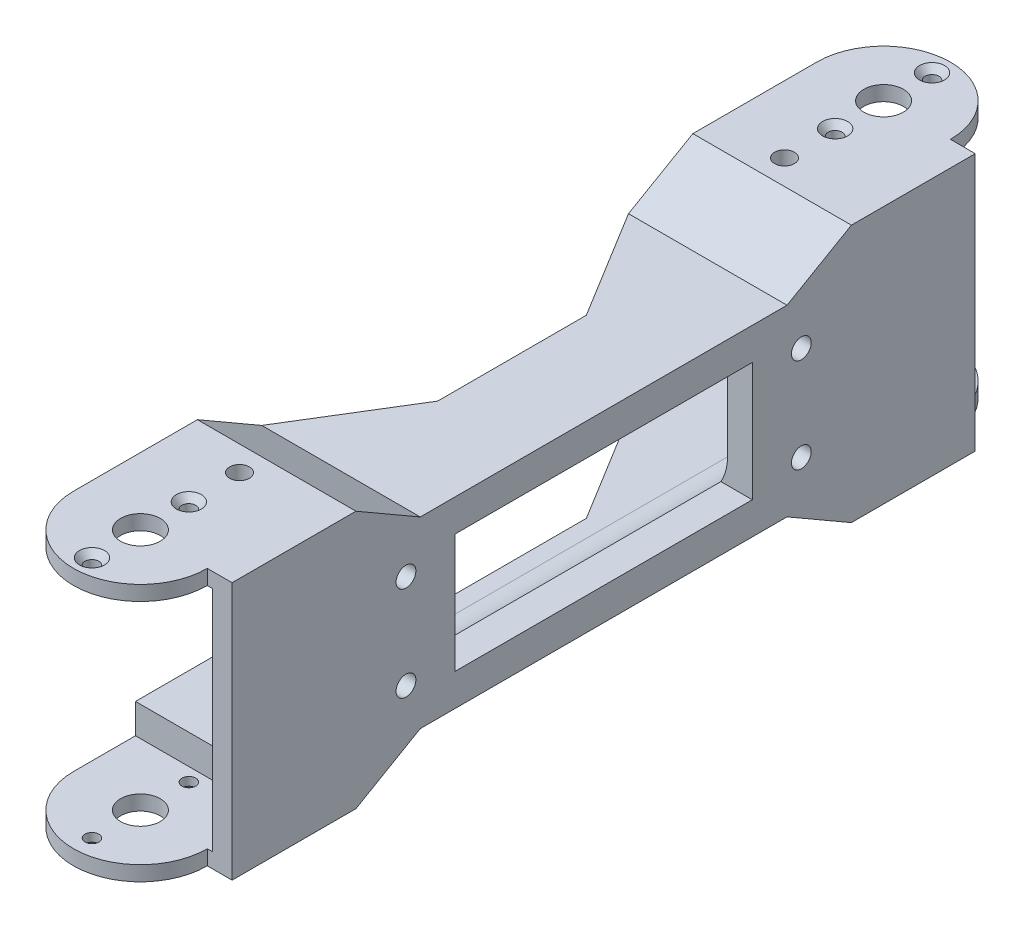
from build123d import *

# Parameters (mm, degrees)
SKETCH1_R                                     = 2
BOSS_EXTRUDE1_DEPTH                           = 26
CUT_EXTRUDE1_DEPTH                            = 97.110613358
CUT_EXTRUDE2_DEPTH                            = 97.110613358
CUT_EXTRUDE2_DEPTH_BACK                       = 97.110613358
SKETCH4_W                                     = 26
SKETCH4_H                                     = 6
SKETCH5_W                                     = 177
SKETCH5_H                                     = 34
CUT_EXTRUDE3_DEPTH                            = 22
SKETCH6_W                                     = 22.988088482
SKETCH6_H                                     = 34
CUT_EXTRUDE4_DEPTH                            = 95.827474922
SKETCH7_W                                     = 22.988088482
SKETCH7_H                                     = 34
CUT_EXTRUDE5_DEPTH                            = 95.827474922
CSK_FOR_3_FLAT_HEAD_MACHINE_SCREW1_AT_2_COUNT = 2
CSK_FOR_3_FLAT_HEAD_MACHINE_SCREW1_AT_2_PITCH = 19.558
SKETCH13_R                                    = 4
CUT_EXTRUDE6_DEPTH                            = 104.530188834
BOSS_EXTRUDE2_DEPTH                           = 5
SKETCH15_W                                    = 125
SKETCH15_H                                    = 34
CUT_EXTRUDE7_DEPTH                            = 5
SKETCH17_W                                    = 4
SKETCH17_H                                    = 52
BOSS_EXTRUDE4_DEPTH                           = 12.5
SKETCH19_R                                    = 2
CUT_EXTRUDE11_DEPTH                           = 10
CUT_EXTRUDE8_REACH                            = 106.3
SKETCH18_R                                    = 2
SKETCH20_W                                    = 60
SKETCH20_H                                    = 24
CUT_EXTRUDE10_DEPTH                           = 10
CUT_EXTRUDE12_REACH                           = 102.771
SKETCH22_W                                    = 5
SKETCH22_H                                    = 46
BOSS_EXTRUDE5_DEPTH                           = 12.5
FILLET1_R                                     = 10


with BuildPart() as part:
    # Sketch1 → Boss-Extrude1 (new, symmetric)
    with BuildSketch(Plane(origin=(0, 0, 0), x_dir=(1, 0, 0), z_dir=(0, 1, 0))):
        with BuildLine():
            Line((-13.5, 75), (-13.5, -75))
            ThreePointArc((-13.5, -75), (0, -88.5), (13.5, -75))
            Line((13.5, -75), (13.5, 75))
            ThreePointArc((13.5, 75), (0, 88.5), (-13.5, 75))
        make_face()
        with Locations(Location((0, -55, 0), (0, 0, 90))):
            Circle(SKETCH1_R, mode=Mode.SUBTRACT)
    extrude(amount=BOSS_EXTRUDE1_DEPTH, both=True)

    # Sketch3 → Cut-Extrude1 (cut, symmetric)
    with BuildSketch(Plane.ZY.offset(13.5)):
        Polygon((-50, 26), (-37.009618943, 18.5), (37.009618943, 18.5), (50, 26), align=None)
    cut_extrude1 = extrude(amount=CUT_EXTRUDE1_DEPTH, both=True, mode=Mode.SUBTRACT)

    # Mirror1: Cut-Extrude1 across plane
    add(cut_extrude1.mirror(Plane.ZX), mode=Mode.SUBTRACT)

    # Sketch4 → Cut-Extrude2 (cut, two sides: drawn at the far end of the back side and taken through both)
    with BuildSketch(Plane.ZY.offset(13.5).offset(-CUT_EXTRUDE2_DEPTH_BACK)):
        with Locations((75.5, 20)):
            Rectangle(SKETCH4_W, SKETCH4_H)
        with Locations((-75.5, 20)):
            Rectangle(SKETCH4_W, SKETCH4_H)
        with Locations((-75.5, -20)):
            Rectangle(SKETCH4_W, SKETCH4_H)
        with Locations((75.5, -20)):
            Rectangle(SKETCH4_W, SKETCH4_H)
    extrude(amount=CUT_EXTRUDE2_DEPTH + CUT_EXTRUDE2_DEPTH_BACK, mode=Mode.SUBTRACT)

    # Sketch5 → Cut-Extrude3 (cut)
    with BuildSketch(Plane.ZY.offset(13.5)):
        Rectangle(SKETCH5_W, SKETCH5_H)
    extrude(amount=-CUT_EXTRUDE3_DEPTH, mode=Mode.SUBTRACT)

    # Sketch6 → Cut-Extrude4 (cut, through all)
    with BuildSketch(Plane.ZY.offset(-8.5)):
        with Locations((73.994044241, 0)):
            Rectangle(SKETCH6_W, SKETCH6_H)
    extrude(amount=-CUT_EXTRUDE4_DEPTH, mode=Mode.SUBTRACT)

    # Sketch7 → Cut-Extrude5 (cut, through all)
    with BuildSketch(Plane.ZY.offset(-8.5)):
        with Locations((-73.994044241, 0)):
            Rectangle(SKETCH7_W, SKETCH7_H)
    extrude(amount=-CUT_EXTRUDE5_DEPTH, mode=Mode.SUBTRACT)

    # Sketch12 → CSK for #3 Flat Head Machine Screw1 (revolve, cut)
    with BuildSketch(Plane(origin=(0, 26, 65.221), x_dir=(0, 0, 1), z_dir=(1, 0, 0))):
        Polygon((0, 0), (0, 3.839402285), (1.397, 3), (1.397, 1.300261411), (2.5273, 0), align=None)
    csk_for_3_flat_head_machine_screw1 = revolve(axis=Axis((0, 32.35, 65.221), (0, -1, 0)), mode=Mode.SUBTRACT)

    # CSK for #3 Flat Head Machine Screw1 at 2: CSK for #3 Flat Head Machine Screw1 ×2
    with Locations(*[(0, 0, i * CSK_FOR_3_FLAT_HEAD_MACHINE_SCREW1_AT_2_PITCH) for i in range(1, CSK_FOR_3_FLAT_HEAD_MACHINE_SCREW1_AT_2_COUNT)]):
        add(csk_for_3_flat_head_machine_screw1, mode=Mode.SUBTRACT)

    # Mirror5: CSK for #3 Flat Head Machine Screw1 across plane
    add(csk_for_3_flat_head_machine_screw1.mirror(Plane.ZX), mode=Mode.SUBTRACT)

    # Mirror5 copy 1 sketch → Mirror5 copy 1 (revolve, cut)
    with BuildSketch(Plane(origin=(0, -26, 84.779), x_dir=(0, 0, 1), z_dir=(1, 0, 0))):
        Polygon((0, 0), (0, -3.839402285), (1.397, -3), (1.397, -1.300261411), (2.5273, 0), align=None)
    revolve(axis=Axis((0, -32.35, 84.779), (0, -1, 0)), mode=Mode.SUBTRACT)

    # Mirror3: CSK for #3 Flat Head Machine Screw1 across plane
    add(csk_for_3_flat_head_machine_screw1.mirror(Plane.XY), mode=Mode.SUBTRACT)

    # Mirror3 copy 1 sketch → Mirror3 copy 1 (revolve, cut)
    with BuildSketch(Plane(origin=(0, 26, -84.779), x_dir=(0, 0, -1), z_dir=(1, 0, 0))):
        Polygon((0, 0), (0, -3.839402285), (1.397, -3), (1.397, -1.300261411), (2.5273, 0), align=None)
    revolve(axis=Axis((0, 32.35, -84.779), (0, 1, 0)), mode=Mode.SUBTRACT)

    # Sketch13 → Cut-Extrude6 (cut, symmetric)
    with BuildSketch(Plane.XZ.offset(26)):
        with Locations(Location((0, -75, 0), (0, 0, 270))):
            Circle(SKETCH13_R)
    cut_extrude6 = extrude(amount=CUT_EXTRUDE6_DEPTH, both=True, mode=Mode.SUBTRACT)

    # Mirror4: Cut-Extrude6 across plane
    add(cut_extrude6.mirror(Plane.XY), mode=Mode.SUBTRACT)

    # Sketch14 → Boss-Extrude2 (add)
    with BuildSketch(Plane(origin=(13.5, 0, 0), x_dir=(0, 0, -1), z_dir=(1, 0, 0))):
        Polygon((-75, 26), (-75, 23), (-62.5, 23), (-62.5, -23), (-75, -23), (-75, -26), (-50, -26), (-37.009618943, -18.5), (37.009618943, -18.5), (50, -26), (75, -26), (75, -23), (62.5, -23), (62.5, 23), (75, 23), (75, 26), (50, 26), (37.009618943, 18.5), (-37.009618943, 18.5), (-50, 26), align=None)
    extrude(amount=BOSS_EXTRUDE2_DEPTH)

    # Sketch15 → Cut-Extrude7 (cut)
    with BuildSketch(Plane.ZY.offset(-8.5)):
        Rectangle(SKETCH15_W, SKETCH15_H)
    extrude(amount=-CUT_EXTRUDE7_DEPTH, mode=Mode.SUBTRACT)

    # Sketch17 → Boss-Extrude4 (add)
    with BuildSketch(Plane.XY.offset(62.5)):
        with Locations((16.5, 0)):
            Rectangle(SKETCH17_W, SKETCH17_H)
    extrude(amount=BOSS_EXTRUDE4_DEPTH)

    # Mirror6 copy 1 sketch → Mirror6 copy 1 (revolve, cut)
    with BuildSketch(Plane(origin=(0, -26, -65.221), x_dir=(0, 0, -1), z_dir=(1, 0, 0))):
        Polygon((0, 0), (0, 3.839402285), (1.397, 3), (1.397, 1.300261411), (2.5273, 0), align=None)
    revolve(axis=Axis((0, -32.35, -65.221), (0, 1, 0)), mode=Mode.SUBTRACT)

    # Mirror6 copy 2 sketch → Mirror6 copy 2 (revolve, cut)
    with BuildSketch(Plane(origin=(0, -26, -84.779), x_dir=(0, 0, -1), z_dir=(1, 0, 0))):
        Polygon((0, 0), (0, 3.839402285), (1.397, 3), (1.397, 1.300261411), (2.5273, 0), align=None)
    revolve(axis=Axis((0, -32.35, -84.779), (0, 1, 0)), mode=Mode.SUBTRACT)

    # Mirror6 copy 3 sketch → Mirror6 copy 3 (revolve, cut)
    with BuildSketch(Plane(origin=(0, -26, 65.221), x_dir=(0, 0, 1), z_dir=(1, 0, 0))):
        Polygon((0, 0), (0, -3.839402285), (1.397, -3), (1.397, -1.300261411), (2.5273, 0), align=None)
    revolve(axis=Axis((0, -32.35, 65.221), (0, -1, 0)), mode=Mode.SUBTRACT)

    # Mirror6 copy 4 sketch → Mirror6 copy 4 (revolve, cut)
    with BuildSketch(Plane(origin=(0, -26, 84.779), x_dir=(0, 0, 1), z_dir=(1, 0, 0))):
        Polygon((0, 0), (0, -3.839402285), (1.397, -3), (1.397, -1.300261411), (2.5273, 0), align=None)
    revolve(axis=Axis((0, -32.35, 84.779), (0, -1, 0)), mode=Mode.SUBTRACT)

    # Sketch19 → Cut-Extrude11 (cut)
    with BuildSketch(Plane(origin=(18.5, 0, 0), x_dir=(0, 0, -1), z_dir=(1, 0, 0))):
        with Locations((-39.898979486, 9.525)):
            Circle(SKETCH19_R)
        with Locations((-39.898979486, -9.525)):
            Circle(SKETCH19_R)
    cut_extrude11 = extrude(amount=-CUT_EXTRUDE11_DEPTH, mode=Mode.SUBTRACT)

    # Cut-Extrude8: up to this face of the body (flat: up to its plane)
    cut_extrude8_end = Plane(part.part.faces().sort_by_distance((0, -26, -87.99937539))[0])
    # Sketch18 → Cut-Extrude8 (cut, up to the picked face)
    with BuildSketch(Plane(origin=(0, 26, 0), x_dir=(1, 0, 0), z_dir=(0, 1, 0)), mode=Mode.PRIVATE) as cut_extrude8_sk1:
        with Locations(Location((0, 55, 0), (0, 0, 270))):
            Circle(SKETCH18_R)
    cut_extrude8_tool1 = split(extrude(cut_extrude8_sk1.sketch, amount=-CUT_EXTRUDE8_REACH, mode=Mode.PRIVATE), bisect_by=cut_extrude8_end, keep=Keep.BOTH, mode=Mode.PRIVATE)
    add(cut_extrude8_tool1.solids().sort_by(Axis((0, 26, -55), (0, -1, 0)))[0], mode=Mode.SUBTRACT)

    # Sketch20 → Cut-Extrude10 (cut)
    with BuildSketch(Plane.ZY.offset(-13.5)):
        Rectangle(SKETCH20_W, SKETCH20_H)
    extrude(amount=-CUT_EXTRUDE10_DEPTH, mode=Mode.SUBTRACT)

    # Mirror7: Cut-Extrude11 across plane
    add(cut_extrude11.mirror(Plane.XY), mode=Mode.SUBTRACT)

    # Sketch21 → Cut-Extrude12 (cut, up to next)
    with BuildSketch(Plane(origin=(0, 18.5, 0), x_dir=(1, 0, 0), z_dir=(0, 1, 0)), mode=Mode.PRIVATE) as cut_extrude12_sk1:
        Polygon((-13.5, 37.009618943), (0, 15), (0, -15), (-13.5, -37.009618943), align=None)
    cut_extrude12_tool1 = extrude(cut_extrude12_sk1.sketch, amount=-CUT_EXTRUDE12_REACH, mode=Mode.PRIVATE) & part.part
    add(cut_extrude12_tool1.solids().sort_by_distance((-7.702163, 18.5, 0))[0], mode=Mode.SUBTRACT)
    add(cut_extrude12_tool1.solids().sort_by_distance((-7.702163, 18.5, 0))[1], mode=Mode.SUBTRACT)

    # Sketch22 → Boss-Extrude5 (add)
    with BuildSketch(Plane(origin=(0, 0, -62.5), x_dir=(-1, 0, 0), z_dir=(0, 0, -1))):
        with Locations((-16, 0)):
            Rectangle(SKETCH22_W, SKETCH22_H)
    extrude(amount=BOSS_EXTRUDE5_DEPTH)

    # Fillet1
    # the kernel refuses this fillet: 10 mm, written as the material it adds along each edge
    with BuildSketch(Plane(origin=(13.5, 17, -62.5), x_dir=(0, -1, 0), z_dir=(0, 0, 1))) as fillet1_piece_1_section:
        with BuildLine():
            CenterArc((FILLET1_R, -FILLET1_R), FILLET1_R, 90, 90)
            Line((0, -FILLET1_R), (0, 0))
            Line((0, 0), (FILLET1_R, 0))
        make_face()
    fillet1_piece_1 = extrude(amount=150, mode=Mode.PRIVATE)
    fillet1_piece_1 = fillet1_piece_1 - Plane(origin=(13.095089825, 9.525, -39.898979486), x_dir=(0, 0, 1), z_dir=(1, 0, 0)) * Cylinder(2, 341, mode=Mode.PRIVATE)
    fillet1_piece_1 = split(fillet1_piece_1, bisect_by=Plane(origin=(13.095089825, 10.807057583, -30), z_dir=(0, 0, -1)), keep=Keep.TOP, mode=Mode.PRIVATE)
    add(fillet1_piece_1)
    with BuildSketch(Plane(origin=(13.5, 17, -62.5), x_dir=(0, -1, 0), z_dir=(0, 0, 1))) as fillet1_piece_2_section:
        with BuildLine():
            CenterArc((FILLET1_R, -FILLET1_R), FILLET1_R, 90, 90)
            Line((0, -FILLET1_R), (0, 0))
            Line((0, 0), (FILLET1_R, 0))
        make_face()
    fillet1_piece_2 = extrude(amount=125, mode=Mode.PRIVATE)
    fillet1_piece_2 = split(fillet1_piece_2, bisect_by=Plane(origin=(11.059751506, 12, 0), z_dir=(0, 1, 0)), keep=Keep.TOP, mode=Mode.PRIVATE)
    add(fillet1_piece_2)
    with BuildSketch(Plane(origin=(13.5, 17, -87.5), x_dir=(0, -1, 0), z_dir=(0, 0, 1))) as fillet1_piece_3_section:
        with BuildLine():
            CenterArc((FILLET1_R, -FILLET1_R), FILLET1_R, 90, 90)
            Line((0, -FILLET1_R), (0, 0))
            Line((0, 0), (FILLET1_R, 0))
        make_face()
    fillet1_piece_3 = extrude(amount=150, mode=Mode.PRIVATE)
    fillet1_piece_3 = fillet1_piece_3 - Plane(origin=(13.095089825, 9.525, 39.898979486), x_dir=(0, 0, -1), z_dir=(1, 0, 0)) * Cylinder(2, 341, mode=Mode.PRIVATE)
    fillet1_piece_3 = split(fillet1_piece_3, bisect_by=Plane(origin=(13.095089825, 10.807057583, 30), z_dir=(0, 0, 1)), keep=Keep.TOP, mode=Mode.PRIVATE)
    add(fillet1_piece_3)
    with BuildSketch(Plane(origin=(13.5, -17, 62.5), x_dir=(-1, 0, 0), z_dir=(0, 0, -1))) as fillet1_piece_4_section:
        with BuildLine():
            CenterArc((FILLET1_R, FILLET1_R), FILLET1_R, 180, 90)
            Line((0, FILLET1_R), (0, 0))
            Line((0, 0), (FILLET1_R, 0))
        make_face()
    fillet1_piece_4 = extrude(amount=125, mode=Mode.PRIVATE)
    fillet1_piece_4 = split(fillet1_piece_4, bisect_by=Plane(origin=(11.059751506, -12, 46.25), z_dir=(0, -1, 0)), keep=Keep.TOP, mode=Mode.PRIVATE)
    add(fillet1_piece_4)
    with BuildSketch(Plane(origin=(13.5, -17, 62.5), x_dir=(-1, 0, 0), z_dir=(0, 0, -1))) as fillet1_piece_5_section:
        with BuildLine():
            CenterArc((FILLET1_R, FILLET1_R), FILLET1_R, 180, 90)
            Line((0, FILLET1_R), (0, 0))
            Line((0, 0), (FILLET1_R, 0))
        make_face()
    fillet1_piece_5 = extrude(amount=150, mode=Mode.PRIVATE)
    fillet1_piece_5 = split(fillet1_piece_5, bisect_by=Plane(origin=(13.095085978, -10.807036513, 30), z_dir=(0, 0, 1)), keep=Keep.TOP, mode=Mode.PRIVATE)
    fillet1_piece_5 = fillet1_piece_5 - Plane(origin=(13.095085978, -9.525, 39.898979486), x_dir=(0, 0, -1), z_dir=(1, 0, 0)) * Cylinder(2, 341, mode=Mode.PRIVATE)
    add(fillet1_piece_5)
    with BuildSketch(Plane(origin=(13.5, -17, 87.5), x_dir=(-1, 0, 0), z_dir=(0, 0, -1))) as fillet1_piece_6_section:
        with BuildLine():
            CenterArc((FILLET1_R, FILLET1_R), FILLET1_R, 180, 90)
            Line((0, FILLET1_R), (0, 0))
            Line((0, 0), (FILLET1_R, 0))
        make_face()
    fillet1_piece_6 = extrude(amount=150, mode=Mode.PRIVATE)
    fillet1_piece_6 = split(fillet1_piece_6, bisect_by=Plane(origin=(13.095085978, -10.807036513, -30), z_dir=(0, 0, -1)), keep=Keep.TOP, mode=Mode.PRIVATE)
    fillet1_piece_6 = fillet1_piece_6 - Plane(origin=(13.095085978, -9.525, -39.898979486), x_dir=(0, 0, 1), z_dir=(1, 0, 0)) * Cylinder(2, 341, mode=Mode.PRIVATE)
    add(fillet1_piece_6)


solid = part.part
